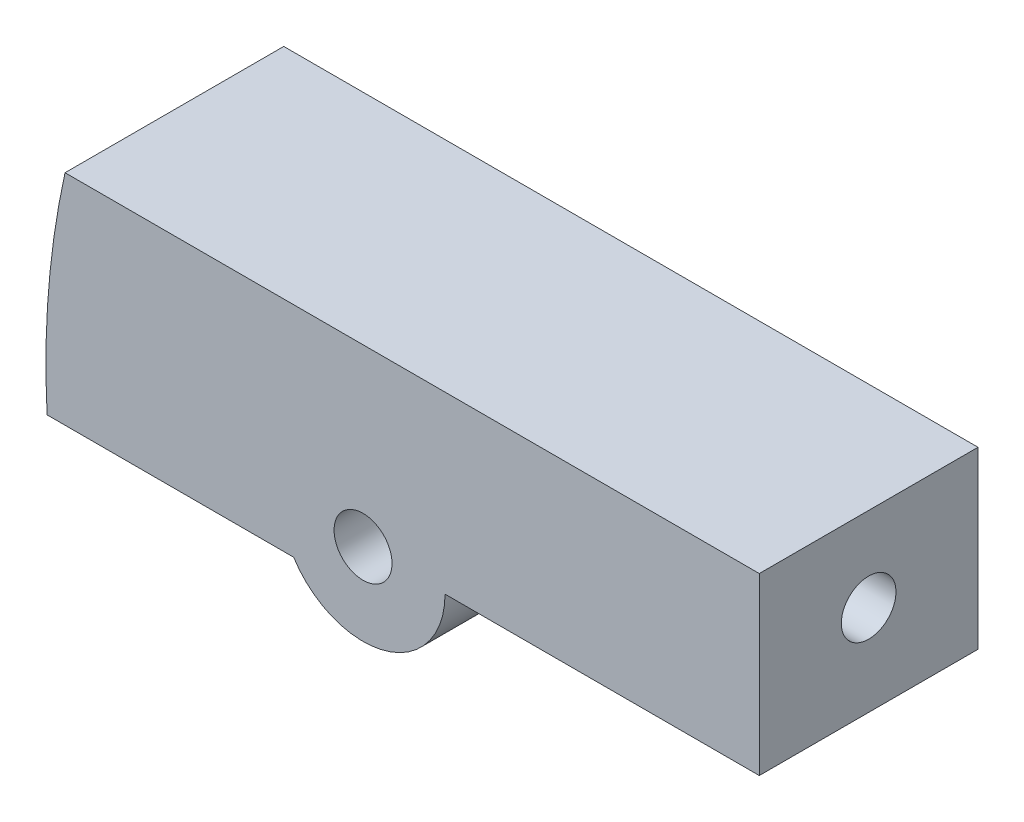
from build123d import *

# Parameters (mm, degrees)
SKETCH2_R           = 2.65
BOSS_EXTRUDE1_DEPTH = 10
SKETCH4_R           = 75.7
SKETCH4_R_2         = 74
CUT_EXTRUDE5_DEPTH  = 80.915518032
SKETCH5_W           = 3
SKETCH5_H           = 16
CUT_EXTRUDE6_DEPTH  = 79.307087942


with BuildPart() as part:
    # Sketch2 → Boss-Extrude1 (new, symmetric)
    with BuildSketch(Plane.XY):
        with BuildLine():
            ThreePointArc((-73.989796594, 16), (-75.457580373, 6.053392794), (-75.594245813, -4))
            Line((-75.594245813, -4), (-51.34428877, -4))
            ThreePointArc((-51.34428877, -4), (-42.918193786, -7.205281597), (-37.5, 0))
            Line((-37.5, 0), (-5.763957799, 0))
            Line((-5.763957799, 0), (-5.763957799, 16))
            Line((-5.763957799, 16), (-73.989796594, 16))
        make_face()
        with Locations((-45, 0)):
            Circle(SKETCH2_R, mode=Mode.SUBTRACT)
    extrude(amount=BOSS_EXTRUDE1_DEPTH, both=True)

    # Sketch3 → Cut-Revolve1 (revolve, cut)
    with BuildSketch(Plane.XY):
        Polygon((-76.243604379, 8.3), (11.256395621, 8.3), (11.256395621, 10.8), (-23.743604379, 10.8), (-25.243604379, 12.3), (-48.243604379, 12.3), (-49.243604379, 13.3), (-70.243604379, 13.3), (-76.243604379, 16.3), align=None)
    revolve(axis=Axis((-75.243604379, 8.3, 0), (1, 0, 0)), mode=Mode.SUBTRACT)

    # Sketch4 → Cut-Extrude5 (cut, through all)
    with BuildSketch(Plane(origin=(0, 0, -10), x_dir=(-1, 0, 0), z_dir=(0, 0, -1))):
        Circle(SKETCH4_R)
        Circle(SKETCH4_R_2, mode=Mode.SUBTRACT)
    extrude(amount=-CUT_EXTRUDE5_DEPTH, mode=Mode.SUBTRACT)

    # Sketch5 → Cut-Extrude6 (cut, through all)
    with BuildSketch(Plane(origin=(0, 0, -10), x_dir=(-1, 0, 0), z_dir=(0, 0, -1))):
        with Locations((7.263957799, 8)):
            Rectangle(SKETCH5_W, SKETCH5_H)
    extrude(amount=-CUT_EXTRUDE6_DEPTH, mode=Mode.SUBTRACT)


solid = part.part
